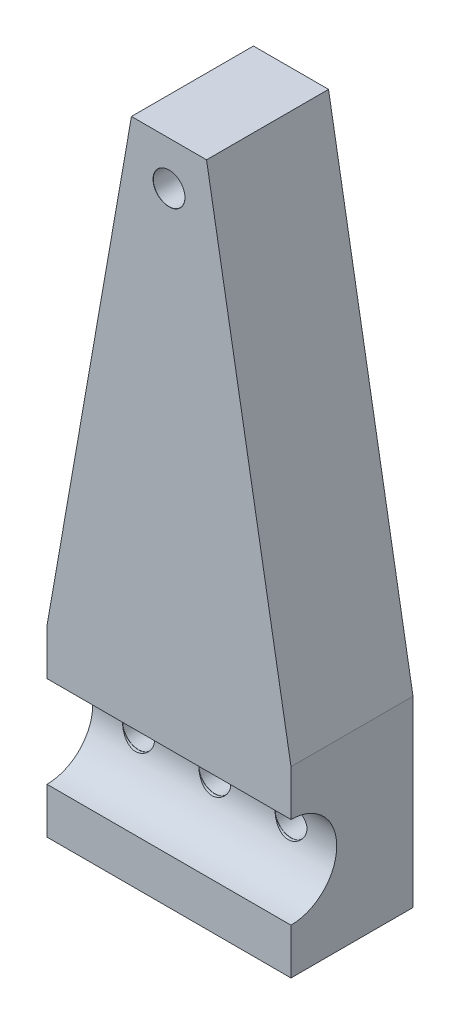
from build123d import *

# Parameters (mm, degrees)
BOSS_EXTRUDE1_DEPTH                      = 25.4
CUT_SWEEP1_PROFILE_R                     = 9.525
M6_CLEARANCE_HOLE1_D                     = 6.6
M6_CLEARANCE_HOLE1_CSINK_D               = 6.65
M6_CLEARANCE_HOLE1_CSINK_ANGLE           = 90
M6_CLEARANCE_HOLE1_ON_FACE_2_D           = 6.6
M6_CLEARANCE_HOLE1_ON_FACE_2_CSINK_D     = 6.65
M6_CLEARANCE_HOLE1_ON_FACE_2_CSINK_ANGLE = 90


with BuildPart() as part:
    # Sketch1 → Boss-Extrude1 (new body)
    with BuildSketch(Plane.XY):
        Polygon((-7.816356176, 119.676226464), (-25.4, 19.05), (-25.4, -19.05), (25.4, -19.05), (25.4, 19.05), (7.816356176, 119.676226464), align=None)
    extrude(amount=BOSS_EXTRUDE1_DEPTH)

    # Cut-Sweep1: sweep along a path in Sketch2
    with BuildLine(Plane.XY.offset(25.4)) as cut_sweep1_path:
        Line((-25.4, 0), (25.4, 0))
    # Cut-Sweep1 profile (on start of the path) → Cut-Sweep1 (sweep, cut)
    with BuildSketch(Plane(origin=(-25.4, 0, 25.4), x_dir=(0, 1, 0), z_dir=(1, 0, 0))):
        Circle(CUT_SWEEP1_PROFILE_R)
    sweep(path=cut_sweep1_path.line, mode=Mode.SUBTRACT)

    # M6 Clearance Hole1 (through all)
    with Locations(Plane(origin=(0, 0, 15.875), x_dir=(0, 1, 0), z_dir=(0, 0, 1))):
        with Locations((0, 0), (0, 15.875), (0, -15.875)):
            CounterSinkHole(M6_CLEARANCE_HOLE1_D / 2, M6_CLEARANCE_HOLE1_CSINK_D / 2, counter_sink_angle=M6_CLEARANCE_HOLE1_CSINK_ANGLE)

    # M6 Clearance Hole1 on face 2 (through all)
    with Locations(Plane(origin=(0, 110.618939397, 25.4), x_dir=(1, 0, 0), z_dir=(0, 0, 1))):
        with Locations((0, 0)):
            CounterSinkHole(M6_CLEARANCE_HOLE1_ON_FACE_2_D / 2, M6_CLEARANCE_HOLE1_ON_FACE_2_CSINK_D / 2, counter_sink_angle=M6_CLEARANCE_HOLE1_ON_FACE_2_CSINK_ANGLE)


solid = part.part
